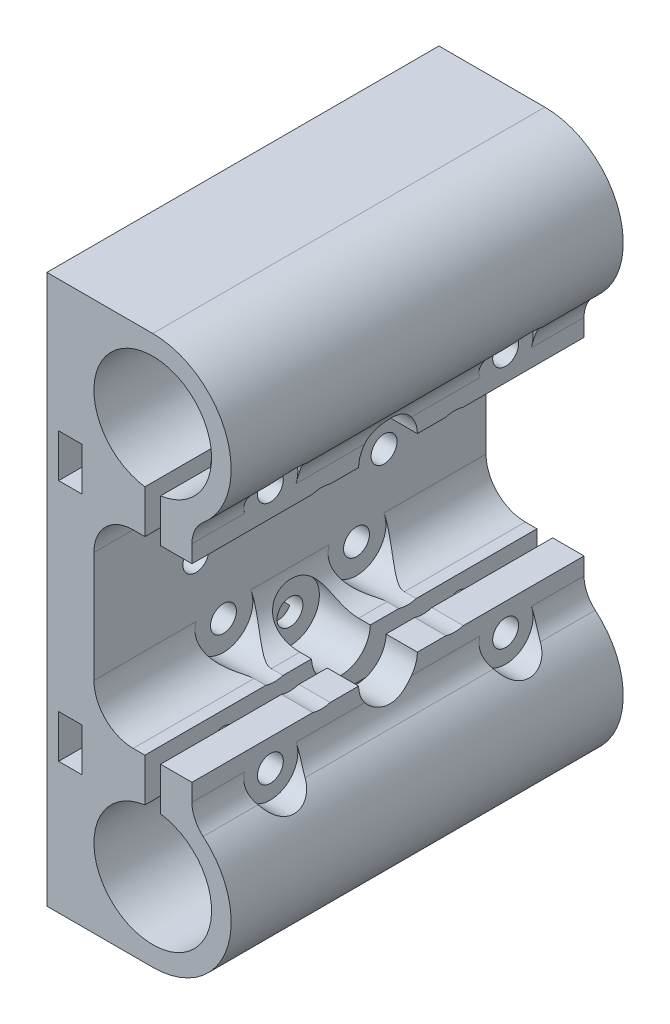
from build123d import *

# Parameters (mm, degrees)
ESBO_O1_W                  = 3
ESBO_O1_H                  = 5.5
RESSALTO_EXTRUS_O1_DEPTH   = 50
CORTE_EXTRUS_O1_DEPTH      = 64.492125496
CORTE_EXTRUS_O1_DEPTH_BACK = 64.492125496
ESBO_O2_R                  = 1.65
ESBO_O5_R                  = 3.75
CORTE_EXTRUS_O2_DEPTH      = 64.492125575
CORTE_EXTRUS_O3_DEPTH      = 63.731571079
CORTE_EXTRUS_O3_DEPTH_BACK = 63.731571079
ESBO_O6_R                  = 1.65
ESBO_O7_R                  = 3.5
CORTE_EXTRUS_O4_DEPTH      = 10


with BuildPart() as part:
    # Esboço1 → Ressalto-extrusão1 (new body)
    with BuildSketch(Plane.XY):
        with BuildLine():
            Line((0, 35), (0, -35))
            Line((0, -35), (13.5, -35))
            ThreePointArc((13.5, -35), (22.896770968, -28.420627921), (19.928571429, -17.340139075))
            ThreePointArc((19.928571429, -17.340139075), (18.874692131, -15.966503215), (18.5, -14.276194705))
            Line((18.5, -14.276194705), (18.5, -12.066965626))
            Line((18.5, -12.066965626), (14.5, -12.066965626))
            Line((14.5, -12.066965626), (14.5, -17.566965626))
            ThreePointArc((14.5, -17.566965626), (13.5, -32.5), (12.5, -17.566965626))
            Line((12.5, -17.566965626), (12.5, -12.066965626))
            Line((12.5, -12.066965626), (11, -12.066965626))
            ThreePointArc((11, -12.066965626), (7.464466094, -10.602499532), (6, -7.066965626))
            Line((6, -7.066965626), (6, 7.066965626))
            ThreePointArc((6, 7.066965626), (7.464466094, 10.602499532), (11, 12.066965626))
            Line((11, 12.066965626), (12.5, 12.066965626))
            Line((12.5, 12.066965626), (12.5, 17.566965626))
            ThreePointArc((12.5, 17.566965626), (13.5, 32.5), (14.5, 17.566965626))
            Line((14.5, 17.566965626), (14.5, 12.066965626))
            Line((14.5, 12.066965626), (18.5, 12.066965626))
            Line((18.5, 12.066965626), (18.5, 14.276194705))
            ThreePointArc((18.5, 14.276194705), (18.874692131, 15.966503215), (19.928571429, 17.340139075))
            ThreePointArc((19.928571429, 17.340139075), (22.896770968, 28.420627921), (13.5, 35))
            Line((13.5, 35), (0, 35))
        make_face()
        with Locations((3, 15.5)):
            Rectangle(ESBO_O1_W, ESBO_O1_H, mode=Mode.SUBTRACT)
        with Locations((3, -15.5)):
            Rectangle(ESBO_O1_W, ESBO_O1_H, mode=Mode.SUBTRACT)
    extrude(amount=RESSALTO_EXTRUS_O1_DEPTH)

    # Esboço2 → Corte-extrusão1 (cut, two sides: drawn at the far end of the back side and taken through both)
    with BuildSketch(Plane(origin=(6, 0, 0), x_dir=(0, 0, -1), z_dir=(1, 0, 0)).offset(-CORTE_EXTRUS_O1_DEPTH_BACK)):
        with Locations((-25, 12)):
            Circle(ESBO_O2_R)
        with Locations((-16.514718626, 8.485281374)):
            Circle(ESBO_O2_R)
        with Locations((-13, 0)):
            Circle(ESBO_O2_R)
        with Locations((-16.514718626, -8.485281374)):
            Circle(ESBO_O2_R)
        with Locations((-25, -12)):
            Circle(ESBO_O2_R)
        with Locations((-33.485281374, -8.485281374)):
            Circle(ESBO_O2_R)
        with Locations((-37, 0)):
            Circle(ESBO_O2_R)
        with Locations((-33.485281374, 8.485281374)):
            Circle(ESBO_O2_R)
    extrude(amount=CORTE_EXTRUS_O1_DEPTH + CORTE_EXTRUS_O1_DEPTH_BACK, mode=Mode.SUBTRACT)

    # Esboço5 → Corte-extrusão2 (cut, through all)
    with BuildSketch(Plane(origin=(6, 0, 0), x_dir=(0, 0, -1), z_dir=(1, 0, 0))):
        with Locations((-25, 12)):
            Circle(ESBO_O5_R)
        with Locations((-16.514718626, 8.485281374)):
            Circle(ESBO_O5_R)
        with Locations((-13, 0)):
            Circle(ESBO_O5_R)
        with Locations((-16.514718626, -8.485281374)):
            Circle(ESBO_O5_R)
        with Locations((-25, -12)):
            Circle(ESBO_O5_R)
        with Locations((-33.485281374, -8.485281374)):
            Circle(ESBO_O5_R)
        with Locations((-37, 0)):
            Circle(ESBO_O5_R)
        with Locations((-33.485281374, 8.485281374)):
            Circle(ESBO_O5_R)
    extrude(amount=CORTE_EXTRUS_O2_DEPTH, mode=Mode.SUBTRACT)

    # Esboço6 → Corte-extrusão3 (cut, two sides: drawn at the far end of the back side and taken through both)
    with BuildSketch(Plane.ZY.offset(-14.5).offset(-CORTE_EXTRUS_O3_DEPTH_BACK)):
        with Locations((10, 15.533482813)):
            Circle(ESBO_O6_R)
        with Locations((40, 15.533482813)):
            Circle(ESBO_O6_R)
        with Locations((40, -15.533482813)):
            Circle(ESBO_O6_R)
        with Locations((10, -15.533482813)):
            Circle(ESBO_O6_R)
    extrude(amount=CORTE_EXTRUS_O3_DEPTH + CORTE_EXTRUS_O3_DEPTH_BACK, mode=Mode.SUBTRACT)

    # Esboço7 → Corte-extrusão4 (cut)
    with BuildSketch(Plane(origin=(18.5, 0, 0), x_dir=(0, 0, -1), z_dir=(1, 0, 0))):
        with Locations((-40, 15.533482813)):
            Circle(ESBO_O7_R)
        with Locations((-10, 15.533482813)):
            Circle(ESBO_O7_R)
        with Locations((-10, -15.533482813)):
            Circle(ESBO_O7_R)
        with Locations((-40, -15.533482813)):
            Circle(ESBO_O7_R)
    extrude(amount=CORTE_EXTRUS_O4_DEPTH, mode=Mode.SUBTRACT)


solid = part.part
